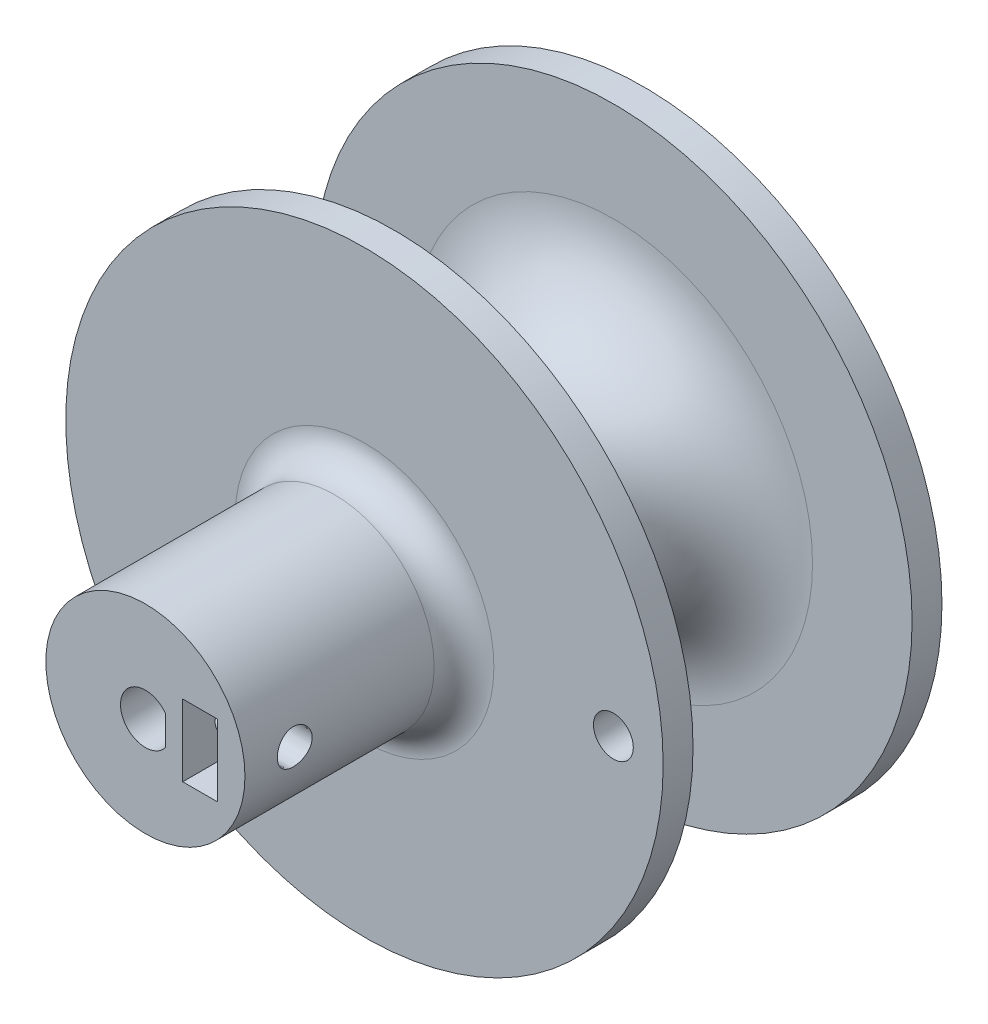
from build123d import *

# Parameters (mm, degrees)
CROQUIS1_R              = 10
SALIENTE_EXTRUIR2_DEPTH = 50
CROQUIS4_R              = 30
SALIENTE_EXTRUIR3_DEPTH = 3
SALIENTE_EXTRUIR4_START = 25
CROQUIS5_R              = 30
SALIENTE_EXTRUIR4_DEPTH = 3
REDONDEO2_R             = 10
CORTAR_EXTRUIR1_START   = 50
CORTAR_EXTRUIR1_DEPTH   = 20
CORTAR_EXTRUIR2_START   = 50
CROQUIS7_W              = 3.5
CROQUIS7_H              = 7.2
CORTAR_EXTRUIR2_DEPTH   = 10
CORTAR_EXTRUIR3_START   = 1.785357468
CORTAR_EXTRUIR3_DEPTH   = 8.214642632
CORTAR_EXTRUIR4_START   = 25
CROQUIS9_R              = 2
CORTAR_EXTRUIR4_DEPTH   = 3
REDONDEO3_R             = 3


# Read off the part's stored shape, not the designer's step: Cortar-Extruir3
with BuildPart() as part:
    # Croquis1 → Saliente-Extruir2 (new body)
    with BuildSketch(Plane.XY):
        Circle(CROQUIS1_R)
    extrude(amount=SALIENTE_EXTRUIR2_DEPTH)

    # Croquis4 → Saliente-Extruir3 (add)
    with BuildSketch(Plane.XY):
        Circle(CROQUIS4_R)
    extrude(amount=SALIENTE_EXTRUIR3_DEPTH)

    # Croquis5 → Saliente-Extruir4 (add)
    with BuildSketch(Plane.XY.offset(SALIENTE_EXTRUIR4_START)):
        Circle(CROQUIS5_R)
    extrude(amount=SALIENTE_EXTRUIR4_DEPTH)

    # Redondeo2
    redondeo2_edges = [part.edges().sort_by_distance(p)[0] for p in [
        (-10, 0, 25),
        (-10, 0, 3),
    ]]
    fillet(redondeo2_edges, radius=REDONDEO2_R)

    # Croquis6 → Cortar-Extruir1 (cut)
    with BuildSketch(Plane.XY.offset(CORTAR_EXTRUIR1_START)):
        with BuildLine():
            Line((2, 1.5), (2, -1.5))
            ThreePointArc((2, -1.5), (-2.5, 0), (2, 1.5))
        make_face()
    extrude(amount=-CORTAR_EXTRUIR1_DEPTH, mode=Mode.SUBTRACT)

    # Croquis7 → Cortar-Extruir2 (cut)
    with BuildSketch(Plane.XY.offset(CORTAR_EXTRUIR2_START)):
        with Locations((5.5, 0)):
            Rectangle(CROQUIS7_W, CROQUIS7_H)
    extrude(amount=-CORTAR_EXTRUIR2_DEPTH, mode=Mode.SUBTRACT)

    # Cortar-Extruir3 outline → Cortar-Extruir3 (cut)
    with BuildSketch(Plane(origin=(0, 0, 0), x_dir=(0, 0, -1), z_dir=(1, 0, 0)).offset(CORTAR_EXTRUIR3_START)):
        with BuildLine():
            add(Edge.make_bspline(
                [(-43.250000008, 0), (-43.250010298, 0.457042806), (-43.439269311, 0.91355666), (-44.08377392, 1.559232298), (-44.536167579, 1.749638189), (-45.461098225, 1.750360744), (-45.914256169, 1.560125471), (-46.558728463, 0.916635921), (-46.75, 0.463408547), (-46.75, -0.463408547), (-46.559497121, -0.915462774), (-45.915045576, -1.559741953), (-45.458501244, -1.749734355), (-44.543528816, -1.750265056), (-44.088756623, -1.563446648), (-43.437067231, -0.912124478), (-43.250180582, -0.457964068), (-43.250000045, -0.000460382), (-43.250000003, -0.000230191), (-43.250000008, 0)],
                knots=[0.500062925, 0.500062925, 0.500062925, 0.500062925, 0.625, 0.625, 0.750000001, 0.750000001, 0.875000002, 0.875000002, 1.000000004, 1.000000004, 1.125000006, 1.125000006, 1.250000009, 1.250000009, 1.375000013, 1.375000013, 1.500000015, 1.500000015, 1.50006294, 1.50006294, 1.50006294, 1.50006294], degree=3))
        make_face()
    extrude(amount=CORTAR_EXTRUIR3_DEPTH, mode=Mode.SUBTRACT)

    # Croquis9 → Cortar-Extruir4 (cut)
    with BuildSketch(Plane.XY.offset(CORTAR_EXTRUIR4_START)):
        with Locations((25, 0)):
            Circle(CROQUIS9_R)
    extrude(amount=CORTAR_EXTRUIR4_DEPTH, mode=Mode.SUBTRACT)

    # Redondeo3
    redondeo3_edges = [part.edges().sort_by_distance(p)[0] for p in [
        (-10, 0, 28),
    ]]
    fillet(redondeo3_edges, radius=REDONDEO3_R)


solid = part.part
